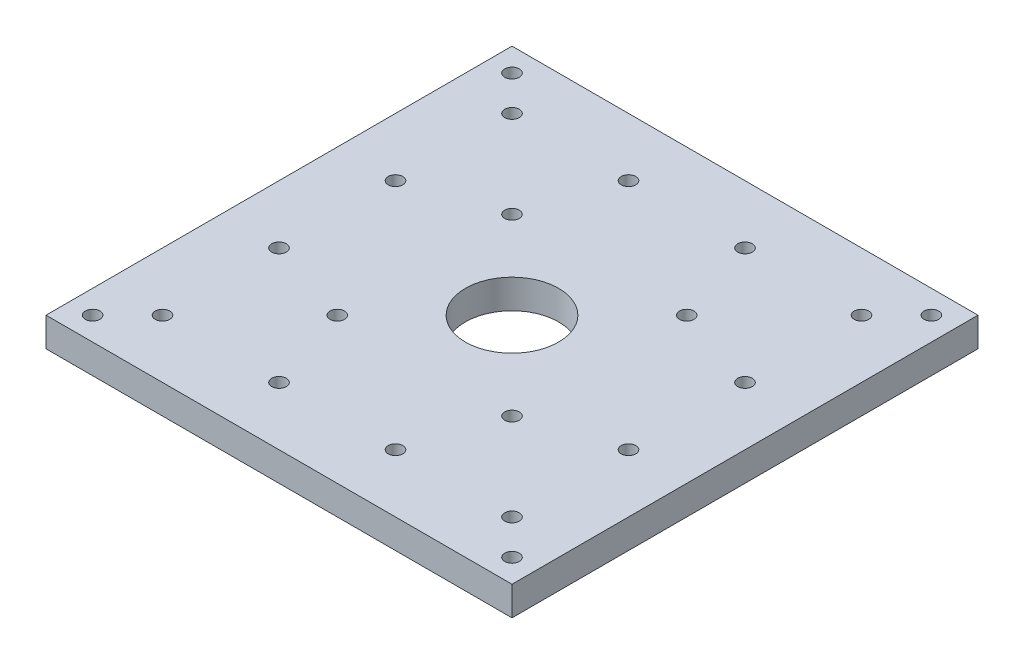
from build123d import *

# Parameters (mm, degrees)
ESQUISSE1_W                     = 80
ESQUISSE1_H                     = 80
ESQUISSE1_R                     = 1.25
ESQUISSE1_R_2                   = 8
EXTRUSION1_DEPTH                = 5
ESQUISSE2_R                     = 1.25
ENL_V_MAT_EXTRU_1_DEPTH         = 57.789083458
R_P_TITION_LIN_AIRE1_COUNT      = 4
R_P_TITION_LIN_AIRE1_PITCH      = 20
R_P_TITION_LIN_AIRE1_COUNT_DIR2 = 4
R_P_TITION_LIN_AIRE1_PITCH_DIR2 = 20


with BuildPart() as part:
    # Esquisse1 → Extrusion1 (new body)
    with BuildSketch(Plane(origin=(0, 0, 0), x_dir=(1, 0, 0), z_dir=(0, 1, 0))):
        Rectangle(ESQUISSE1_W, ESQUISSE1_H)
        with Locations((-15, 15)):
            Circle(ESQUISSE1_R, mode=Mode.SUBTRACT)
        with Locations((15, 15)):
            Circle(ESQUISSE1_R, mode=Mode.SUBTRACT)
        with Locations((-15, -15)):
            Circle(ESQUISSE1_R, mode=Mode.SUBTRACT)
        with Locations((15, -15)):
            Circle(ESQUISSE1_R, mode=Mode.SUBTRACT)
        with Locations((-36, 36)):
            Circle(ESQUISSE1_R, mode=Mode.SUBTRACT)
        with Locations((36, 36)):
            Circle(ESQUISSE1_R, mode=Mode.SUBTRACT)
        with Locations((36, -36)):
            Circle(ESQUISSE1_R, mode=Mode.SUBTRACT)
        with Locations((-36, -36)):
            Circle(ESQUISSE1_R, mode=Mode.SUBTRACT)
        Circle(ESQUISSE1_R_2, mode=Mode.SUBTRACT)
    extrude(amount=EXTRUSION1_DEPTH)

    # Esquisse2 → Enlèv. mat.-Extru.1 (cut, through all)
    with BuildSketch(Plane(origin=(0, 5, 0), x_dir=(1, 0, 0), z_dir=(0, 1, 0))):
        with Locations((-30, 30)):
            Circle(ESQUISSE2_R)
    enl_v_mat_extru_1 = extrude(amount=-ENL_V_MAT_EXTRU_1_DEPTH, mode=Mode.SUBTRACT)

    # Répétition linéaire1: Enl_v. mat.-Extru.1 4 × 4, 4 skipped
    with Locations(*[(j * R_P_TITION_LIN_AIRE1_PITCH_DIR2, 0, i * R_P_TITION_LIN_AIRE1_PITCH) for i in range(R_P_TITION_LIN_AIRE1_COUNT) for j in range(R_P_TITION_LIN_AIRE1_COUNT_DIR2) if (i, j) not in ((0, 0), (1, 1), (1, 2), (2, 1), (2, 2))]):
        add(enl_v_mat_extru_1, mode=Mode.SUBTRACT)


solid = part.part
